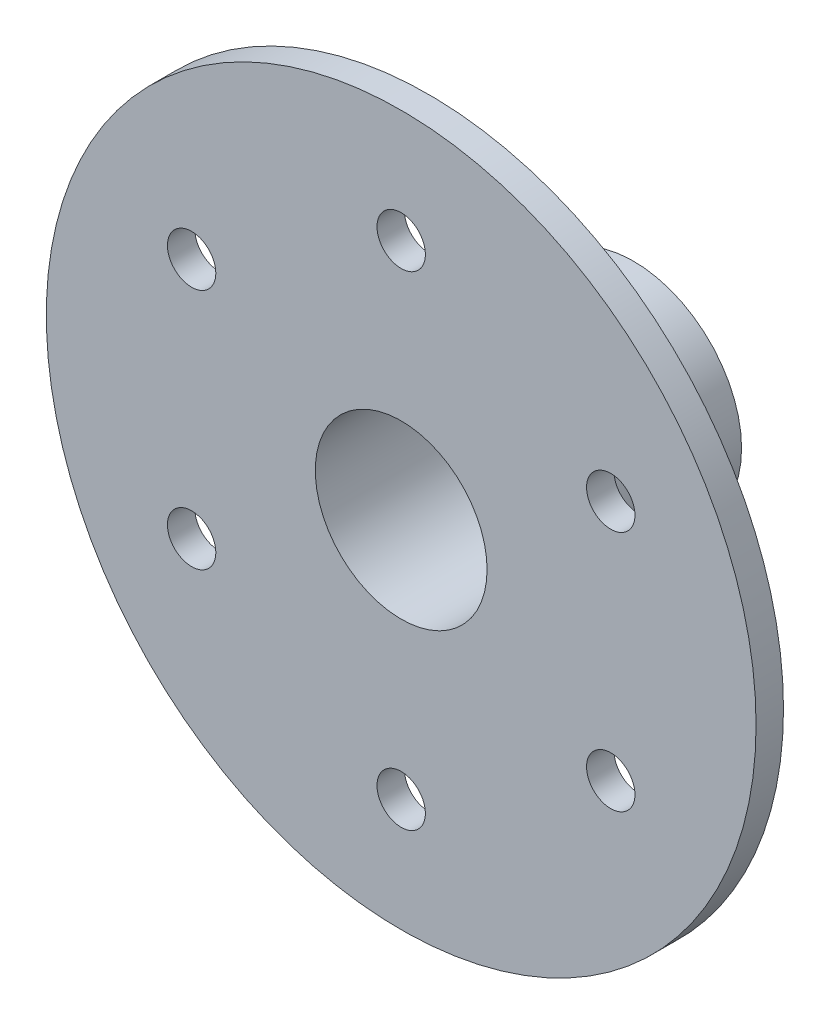
from build123d import *

# Parameters (mm, degrees)
CROQUIS1_R              = 13.4
CROQUIS1_R_2            = 10.65
SALIENTE_EXTRUIR1_DEPTH = 25.4
CROQUIS2_R              = 44
CROQUIS2_R_2            = 10.65
CROQUIS2_R_3            = 3
SALIENTE_EXTRUIR2_DEPTH = 3.4


with BuildPart() as part:
    # Croquis1 → Saliente-Extruir1 (new body)
    with BuildSketch(Plane.XY):
        Circle(CROQUIS1_R)
        Circle(CROQUIS1_R_2, mode=Mode.SUBTRACT)
    extrude(amount=SALIENTE_EXTRUIR1_DEPTH)

    # Croquis2 → Saliente-Extruir2 (add)
    with BuildSketch(Plane.XY.offset(25.4)):
        Circle(CROQUIS2_R)
        Circle(CROQUIS2_R_2, mode=Mode.SUBTRACT)
        with Locations((0, 30)):
            Circle(CROQUIS2_R_3, mode=Mode.SUBTRACT)
        with Locations((25.980762114, 15)):
            Circle(CROQUIS2_R_3, mode=Mode.SUBTRACT)
        with Locations((25.980762114, -15)):
            Circle(CROQUIS2_R_3, mode=Mode.SUBTRACT)
        with Locations((0, -30)):
            Circle(CROQUIS2_R_3, mode=Mode.SUBTRACT)
        with Locations((-25.980762114, -15)):
            Circle(CROQUIS2_R_3, mode=Mode.SUBTRACT)
        with Locations((-25.980762114, 15)):
            Circle(CROQUIS2_R_3, mode=Mode.SUBTRACT)
    extrude(amount=SALIENTE_EXTRUIR2_DEPTH)


solid = part.part
